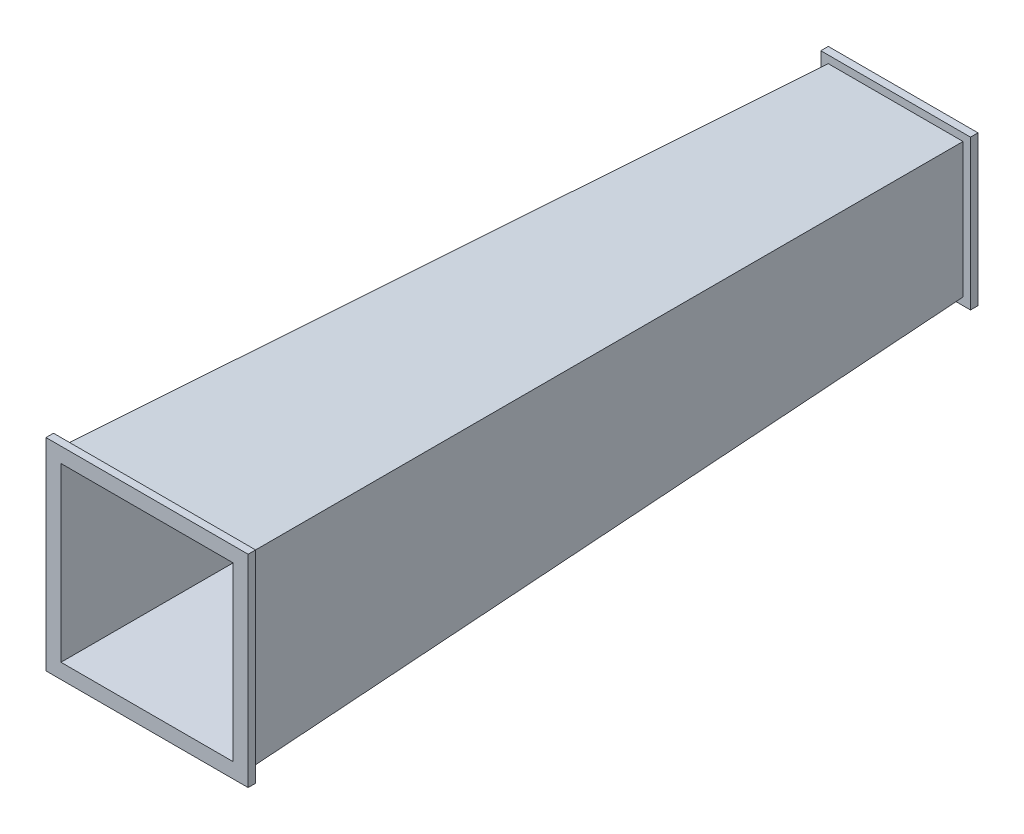
from build123d import *

# Parameters (mm, degrees)
SHELL2_T            = -5
SKETCH5_W           = 100
SKETCH5_H           = 100
SKETCH5_W_2         = 90
SKETCH5_H_2         = 90
BOSS_EXTRUDE1_DEPTH = 5
SKETCH6_W           = 135
SKETCH6_H           = 135
SKETCH6_W_2         = 114.993876874
SKETCH6_H_2         = 114.993876874
BOSS_EXTRUDE2_DEPTH = 5


with BuildPart() as part:
    # Sketch4 → Loft2 section 0
    with BuildSketch(Plane.XY.offset(500)):
        with BuildLine():
            Line((-62.5, 62.5), (62.5, 62.5))
            Line((62.5, 62.5), (62.5, -62.5))
            Line((62.5, -62.5), (-62.5, -62.5))
            Line((-62.5, -62.5), (-62.5, 62.5))
        make_face()
    # Sketch1 → Loft2 section 1
    with BuildSketch(Plane.XY):
        with BuildLine():
            Line((-45, 45), (45, 45))
            Line((45, 45), (45, -45))
            Line((45, -45), (-45, -45))
            Line((-45, -45), (-45, 45))
        make_face()
    loft()

    # Shell2
    shell2_openings = [part.faces().sort_by_distance(p)[0] for p in [
        (0, 0, 0),
        (0, 0, 500),
    ]]
    offset(amount=SHELL2_T, openings=shell2_openings, kind=Kind.INTERSECTION)

    # Sketch6 → Boss-Extrude2 (add)
    with BuildSketch(Plane.XY.offset(500)):
        Rectangle(SKETCH6_W, SKETCH6_H)
        Rectangle(SKETCH6_W_2, SKETCH6_H_2, mode=Mode.SUBTRACT)
    extrude(amount=-BOSS_EXTRUDE2_DEPTH)


with BuildPart() as body_2:
    # Sketch5 → Boss-Extrude1 (new body)
    with BuildSketch(Plane(origin=(0, 0, 0), x_dir=(-1, 0, 0), z_dir=(0, 0, -1))):
        Rectangle(SKETCH5_W, SKETCH5_H)
        Rectangle(SKETCH5_W_2, SKETCH5_H_2, mode=Mode.SUBTRACT)
    extrude(amount=BOSS_EXTRUDE1_DEPTH)


solid = Compound([part.part, body_2.part])
